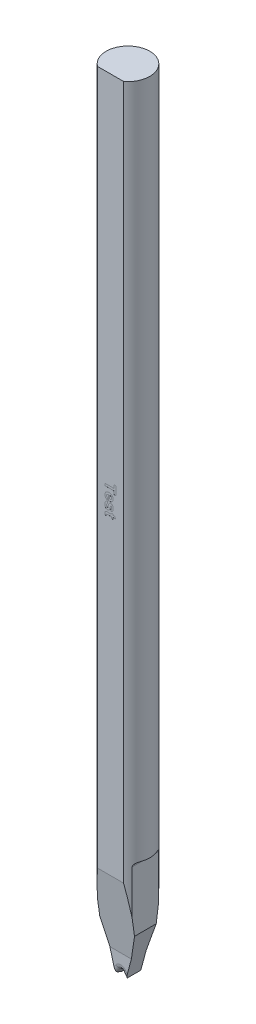
from build123d import *

# Parameters (mm, degrees)
SKETCH_TL_CUTTING_R       = 1.99771
TL_CUTTING_DEPTH          = 72.009
SKETCH_TDF_GRINDING_W     = 4.01542
SKETCH_TDF_GRINDING_H     = 4.01542
TDF_GRINDING_DEPTH        = 73.064400167
ENGRAVING_DEPTH           = 0.005
VW_VR_GRINDING_DEPTH      = 2.00771
VW_VR_GRINDING_DEPTH_BACK = 2.00771
ISA_GRINDING_DEPTH        = 2.00771
ISA_GRINDING_DEPTH_BACK   = 2.00771
PRE_FRX_BRX_DEPTH         = 2.00771
PRE_FRX_BRX_DEPTH_BACK    = 2.00771
SKETCH_PRE_FRX_BRX_W      = 1.33334
SKETCH_PRE_FRX_BRX_H      = 1.80086
FR_EDM_R                  = 0.50038
BR_EDM_R                  = 0.24892
FA_BA_GRINDING_DEPTH      = 2.00771
FA_BA_GRINDING_DEPTH_BACK = 2.00771


with BuildPart() as part:
    # sketch_TL_cutting → TL_cutting (new body)
    with BuildSketch(Plane(origin=(0, 0, 0), x_dir=(1, 0, 0), z_dir=(0, 1, 0))):
        Circle(SKETCH_TL_CUTTING_R)
    extrude(amount=TL_CUTTING_DEPTH)

    # sketch_TDF_grinding → TDF_grinding (cut, through all)
    with BuildSketch(Plane(origin=(0, 0, 0), x_dir=(1, 0, 0), z_dir=(0, 1, 0))):
        with Locations((0, -3.60918)):
            Rectangle(SKETCH_TDF_GRINDING_W, SKETCH_TDF_GRINDING_H)
    extrude(amount=TDF_GRINDING_DEPTH, mode=Mode.SUBTRACT)

    # sketch_engraving → engraving (cut)
    # profile 1 of 4: a face of its own
    with BuildSketch(Plane.XY.offset(1.60147)):
        Polygon((-0.5, 39.271616667), (0.333333333, 39.271616667), (0.333333333, 39.566488462), (0.5, 39.566488462), (0.5, 38.784437179), (0.333333333, 38.784437179), (0.333333333, 39.079308974), (-0.5, 39.079308974), align=None)
    # profile 2 of 4: a face of its own
    with BuildSketch(Plane.XY.offset(1.60147)):
        with BuildLine():
            Line((-0.269230769, 38.245975641), (-0.294871795, 38.053667949))
            add(Edge.make_bspline(
                [(-0.294871795, 38.053667949), (-0.303536255, 38.05681341), (-0.32057243, 38.062998057), (-0.344863965, 38.074297447), (-0.36753558, 38.086927941), (-0.38870841, 38.100828818), (-0.40841008, 38.115948344), (-0.426226149, 38.132786464), (-0.442819851, 38.150522903), (-0.457401048, 38.169899569), (-0.470514378, 38.190430953), (-0.481988402, 38.212220233), (-0.491332973, 38.235441665), (-0.499158418, 38.2597436), (-0.505404699, 38.285236347), (-0.509771463, 38.312023912), (-0.51242458, 38.340071927), (-0.512686872, 38.359217543), (-0.512820513, 38.368972436)],
                knots=[0, 0, 0, 0, 1.071172907, 2.106154283, 3.1104349, 4.085737425, 5.048416355, 5.993087888, 6.932482331, 7.868664062, 8.80754521, 9.762367971, 10.726735429, 11.713584758, 12.728370439, 13.774815933, 14.866245336, 16, 16, 16, 16], degree=3))
            add(Edge.make_bspline(
                [(-0.512820513, 38.368972436), (-0.512443282, 38.384215689), (-0.51171073, 38.413816927), (-0.505852845, 38.456649619), (-0.496231539, 38.496468957), (-0.482996444, 38.533340518), (-0.465262586, 38.566968048), (-0.443980436, 38.597603584), (-0.418772334, 38.625277377), (-0.399264925, 38.640792304), (-0.389423077, 38.648619872)],
                knots=[0, 0, 0, 0, 1.15090686, 2.234973544, 3.257507168, 4.240282073, 5.185422152, 6.119941203, 7.051475585, 8, 8, 8, 8], degree=3))
            add(Edge.make_bspline(
                [(-0.389423077, 38.648619872), (-0.381046549, 38.654394615), (-0.364178666, 38.666023262), (-0.336856894, 38.680508975), (-0.307933811, 38.692778192), (-0.277558503, 38.703026223), (-0.245440266, 38.710801085), (-0.211772448, 38.716423673), (-0.176408554, 38.719566462), (-0.152316287, 38.7200751), (-0.140024038, 38.720334615)],
                knots=[0, 0, 0, 0, 0.924739034, 1.862154457, 2.806332648, 3.78003102, 4.774289357, 5.808656063, 6.881942244, 8, 8, 8, 8], degree=3))
            add(Edge.make_bspline(
                [(-0.140024038, 38.720334615), (-0.125455951, 38.720092004), (-0.096984123, 38.719617846), (-0.055513373, 38.715154498), (-0.016425807, 38.707818358), (0.020119322, 38.697410859), (0.054294407, 38.68413375), (0.086062076, 38.66795031), (0.115338437, 38.648566538), (0.141890673, 38.626338649), (0.165678093, 38.601889773), (0.186654734, 38.575901172), (0.204171816, 38.548142799), (0.218793413, 38.519037282), (0.22973775, 38.488097916), (0.237794287, 38.455712574), (0.242700593, 38.421739484), (0.243290251, 38.398569286), (0.243589744, 38.386800962)],
                knots=[0, 0, 0, 0, 1.22208028, 2.38843015, 3.495001974, 4.555551, 5.572102979, 6.566928721, 7.541284444, 8.51191166, 9.466805643, 10.399597494, 11.308905182, 12.215983304, 13.126946664, 14.056451325, 15.012856426, 16, 16, 16, 16], degree=3))
            add(Edge.make_bspline(
                [(0.243589744, 38.386800962), (0.243311261, 38.373629824), (0.242766301, 38.347855288), (0.237650471, 38.310275991), (0.229328986, 38.274795107), (0.217373094, 38.241526508), (0.202375393, 38.21026058), (0.183809309, 38.18120302), (0.161721866, 38.15441694), (0.136526927, 38.129657507), (0.107657568, 38.107731168), (0.075306929, 38.088791461), (0.039386169, 38.073001438), (-6.4395e-05, 38.06017711), (-0.043155579, 38.050702551), (-0.089766999, 38.044217904), (-0.139896801, 38.040520273), (-0.174473137, 38.040736108), (-0.192307692, 38.040847436)],
                knots=[0, 0, 0, 0, 0.994914541, 1.946943474, 2.860007193, 3.744253739, 4.613162343, 5.475451996, 6.343187588, 7.231728884, 8.139057486, 9.075471918, 10.058180036, 11.098621179, 12.205332334, 13.387827392, 14.65263521, 16, 16, 16, 16], degree=3))
            Line((-0.192307692, 38.040847436), (-0.192307692, 38.528026923))
            add(Edge.make_bspline(
                [(-0.192307692, 38.528026923), (-0.199190121, 38.527709192), (-0.212592416, 38.527090467), (-0.232195578, 38.524796627), (-0.250479259, 38.520657909), (-0.267812634, 38.515788971), (-0.283741268, 38.50914089), (-0.298585088, 38.501254096), (-0.312263908, 38.492043492), (-0.324637591, 38.481432151), (-0.335614883, 38.46980259), (-0.345276708, 38.457539783), (-0.353640982, 38.4446797), (-0.360224098, 38.430905392), (-0.365494916, 38.416500027), (-0.36902659, 38.40135782), (-0.371322908, 38.385602139), (-0.371635397, 38.374856811), (-0.371794872, 38.369373077)],
                knots=[0, 0, 0, 0, 1.231638706, 2.398395625, 3.522289669, 4.579947828, 5.613000372, 6.600997726, 7.58103015, 8.554716894, 9.508889492, 10.435482506, 11.342805004, 12.245087657, 13.158904806, 14.079635201, 15.019967576, 16, 16, 16, 16], degree=3))
            add(Edge.make_bspline(
                [(-0.371794872, 38.369373077), (-0.37147122, 38.362073831), (-0.370844355, 38.347936282), (-0.366452232, 38.327557955), (-0.358712143, 38.309068041), (-0.34792154, 38.292272797), (-0.333591606, 38.277328375), (-0.315339539, 38.264799025), (-0.293735149, 38.253844255), (-0.277667648, 38.248684811), (-0.269230769, 38.245975641)],
                knots=[0, 0, 0, 0, 1.004430367, 1.945431754, 2.851730883, 3.749038912, 4.678525969, 5.68064125, 6.782128749, 8, 8, 8, 8], degree=3))
        make_face()
        with BuildLine():
            add(Edge.make_bspline(
                [(-0.076923077, 38.233155128), (-0.0698403, 38.233483639), (-0.056046098, 38.234123437), (-0.035946701, 38.236260056), (-0.017148581, 38.239753965), (0.000200148, 38.244909045), (0.016332408, 38.250857578), (0.031252693, 38.258017474), (0.044751188, 38.266665927), (0.056718236, 38.276608372), (0.067663617, 38.28708548), (0.076749299, 38.298677324), (0.084970517, 38.310417813), (0.091312261, 38.322949906), (0.09644632, 38.335935061), (0.100044461, 38.349509996), (0.102017666, 38.363706733), (0.102379943, 38.373306988), (0.102564103, 38.378187179)],
                knots=[0, 0, 0, 0, 1.317155349, 2.565252013, 3.752617023, 4.863710936, 5.923691592, 6.944619286, 7.932291025, 8.893346204, 9.832040666, 10.740742434, 11.625065814, 12.490654946, 13.343074709, 14.215747339, 15.092993572, 16, 16, 16, 16], degree=3))
            add(Edge.make_bspline(
                [(0.102564103, 38.378187179), (0.102394824, 38.383402132), (0.102061251, 38.393678456), (0.099884751, 38.408748379), (0.096024349, 38.423032459), (0.09079949, 38.436639555), (0.083918898, 38.449540507), (0.0754807, 38.461735603), (0.065590542, 38.473270723), (0.058097667, 38.480221161), (0.054286859, 38.48375609)],
                knots=[0, 0, 0, 0, 1.043516863, 2.056302107, 3.038302912, 3.998520634, 4.966791607, 5.956307719, 6.960596886, 8, 8, 8, 8], degree=3))
            add(Edge.make_bspline(
                [(0.054286859, 38.48375609), (0.050143389, 38.487049206), (0.04181864, 38.493665486), (0.028026538, 38.502086823), (0.013220128, 38.509308805), (-0.002752654, 38.515151047), (-0.019802657, 38.519527844), (-0.037911914, 38.522448646), (-0.057052364, 38.524307277), (-0.070174406, 38.524514764), (-0.076923077, 38.524621474)],
                knots=[0, 0, 0, 0, 0.903766344, 1.81577923, 2.754803886, 3.715080786, 4.716965023, 5.758108642, 6.846994466, 8, 8, 8, 8], degree=3))
            Line((-0.076923077, 38.524621474), (-0.076923077, 38.233155128))
        make_face(mode=Mode.SUBTRACT)
    # profile 3 of 4: a face of its own
    with BuildSketch(Plane.XY.offset(1.60147)):
        with BuildLine():
            Line((-0.282051282, 37.963924359), (-0.256410256, 37.771616667))
            add(Edge.make_bspline(
                [(-0.256410256, 37.771616667), (-0.265392316, 37.769308786), (-0.282694005, 37.764863233), (-0.306215409, 37.753602879), (-0.326584524, 37.739486729), (-0.343301626, 37.721699528), (-0.356462242, 37.70035559), (-0.365240358, 37.675137989), (-0.37099337, 37.646408413), (-0.37151826, 37.62594851), (-0.371794872, 37.615166346)],
                knots=[0, 0, 0, 0, 1.039319445, 2.001988807, 2.911187514, 3.807680854, 4.723381073, 5.705509029, 6.790826147, 8, 8, 8, 8], degree=3))
            add(Edge.make_bspline(
                [(-0.371794872, 37.615166346), (-0.371595476, 37.6033799), (-0.371221553, 37.581277061), (-0.365704055, 37.55056632), (-0.358276706, 37.523830835), (-0.349217718, 37.509115088), (-0.344951923, 37.502185577)],
                knots=[0, 0, 0, 0, 1.198484229, 2.247488828, 3.174758401, 4, 4, 4, 4], degree=3))
            add(Edge.make_bspline(
                [(-0.344951923, 37.502185577), (-0.341742613, 37.498232291), (-0.33550118, 37.490543982), (-0.322943507, 37.482741952), (-0.309159996, 37.477548698), (-0.299329041, 37.477017951), (-0.294270833, 37.476744872)],
                knots=[0, 0, 0, 0, 1.030872991, 2.004830756, 2.973448591, 4, 4, 4, 4], degree=3))
            add(Edge.make_bspline(
                [(-0.294270833, 37.476744872), (-0.29084777, 37.476875774), (-0.284161693, 37.477131458), (-0.274600311, 37.479806895), (-0.265958556, 37.484297368), (-0.261079044, 37.488462599), (-0.258613782, 37.490566987)],
                knots=[0, 0, 0, 0, 1.045349703, 2.041822997, 3.010676005, 4, 4, 4, 4], degree=3))
            add(Edge.make_bspline(
                [(-0.258613782, 37.490566987), (-0.256288912, 37.493632785), (-0.250848162, 37.500807485), (-0.244943535, 37.515139431), (-0.238900398, 37.533545958), (-0.235595409, 37.547422737), (-0.233774038, 37.555070192)],
                knots=[0, 0, 0, 0, 0.66039037, 1.545471194, 2.647315926, 4, 4, 4, 4], degree=3))
            add(Edge.make_bspline(
                [(-0.233774038, 37.555070192), (-0.229705714, 37.573716174), (-0.22194668, 37.609277449), (-0.209757361, 37.659778792), (-0.19774553, 37.704848274), (-0.186203797, 37.744635975), (-0.174918001, 37.779106417), (-0.163759522, 37.808213265), (-0.153049809, 37.832079784), (-0.144879526, 37.845529946), (-0.141225962, 37.851544551)],
                knots=[0, 0, 0, 0, 1.469060602, 2.801765397, 3.998694248, 5.05919304, 5.990566457, 6.789528243, 7.45870461, 8, 8, 8, 8], degree=3))
            add(Edge.make_bspline(
                [(-0.141225962, 37.851544551), (-0.136226873, 37.858402589), (-0.126466322, 37.871792676), (-0.109659896, 37.889628181), (-0.091386741, 37.904751367), (-0.071590355, 37.917116522), (-0.050318141, 37.926554447), (-0.027668833, 37.93345572), (-0.003546555, 37.937452085), (0.013006297, 37.938002888), (0.021434295, 37.938283333)],
                knots=[0, 0, 0, 0, 1.056974227, 2.063706289, 3.045111424, 4.005796011, 4.963194591, 5.937303459, 6.949763919, 8, 8, 8, 8], degree=3))
            add(Edge.make_bspline(
                [(0.021434295, 37.938283333), (0.029124721, 37.938038093), (0.04431443, 37.937553707), (0.06658025, 37.934147557), (0.08788195, 37.928268829), (0.108244702, 37.919987356), (0.127669101, 37.909371186), (0.146109736, 37.896355985), (0.163499189, 37.88105958), (0.18008332, 37.863595441), (0.195101302, 37.843560205), (0.208193344, 37.820898789), (0.219189739, 37.795682252), (0.228160641, 37.767891932), (0.235116926, 37.737522892), (0.240034197, 37.704574691), (0.243059894, 37.669109271), (0.243409494, 37.644619752), (0.243589744, 37.631993269)],
                knots=[0, 0, 0, 0, 0.866628782, 1.711717909, 2.531497577, 3.35182975, 4.18367977, 5.02092497, 5.890294189, 6.790012725, 7.730721042, 8.705258537, 9.733001209, 10.825364086, 11.991866675, 13.2403337, 14.577151382, 16, 16, 16, 16], degree=3))
            add(Edge.make_bspline(
                [(0.243589744, 37.631993269), (0.243446899, 37.619969386), (0.243169634, 37.596630784), (0.240731219, 37.562865029), (0.236899188, 37.531447838), (0.230948561, 37.502523753), (0.223974046, 37.475757243), (0.214898634, 37.451540721), (0.204526083, 37.429543073), (0.19215876, 37.410057891), (0.178364946, 37.392312816), (0.162861914, 37.376343528), (0.145977964, 37.361660901), (0.127601745, 37.348295817), (0.107595464, 37.336522221), (0.085933763, 37.326346763), (0.062896123, 37.317199482), (0.046718542, 37.312484647), (0.038461538, 37.310078205)],
                knots=[0, 0, 0, 0, 1.38031105, 2.679211982, 3.884975083, 5.011116117, 6.067453267, 7.057174624, 7.976132094, 8.854607518, 9.701157373, 10.55241532, 11.405604341, 12.267429654, 13.157569633, 14.066300783, 15.01304394, 16, 16, 16, 16], degree=3))
            Line((0.038461538, 37.310078205), (0.012820513, 37.502385897))
            add(Edge.make_bspline(
                [(0.012820513, 37.502385897), (0.019716836, 37.504290158), (0.033104434, 37.507986834), (0.051141649, 37.517171289), (0.066892754, 37.528329959), (0.079947134, 37.542237254), (0.090451531, 37.559028536), (0.097449696, 37.579068362), (0.101956518, 37.602011397), (0.102353946, 37.618347086), (0.102564103, 37.626985256)],
                knots=[0, 0, 0, 0, 1.018112573, 1.976427386, 2.86989064, 3.759232895, 4.678909429, 5.673224298, 6.76962116, 8, 8, 8, 8], degree=3))
            add(Edge.make_bspline(
                [(0.102564103, 37.626985256), (0.102424935, 37.637692738), (0.102166286, 37.657593004), (0.098045863, 37.684877454), (0.092323932, 37.707867567), (0.085068416, 37.720248276), (0.081730769, 37.72594359)],
                knots=[0, 0, 0, 0, 1.252081424, 2.327041614, 3.230413832, 4, 4, 4, 4], degree=3))
            add(Edge.make_bspline(
                [(0.081730769, 37.72594359), (0.079197183, 37.729025647), (0.074335374, 37.73493994), (0.064913663, 37.741325197), (0.054472552, 37.745380868), (0.047046059, 37.745775133), (0.043269231, 37.745975641)],
                knots=[0, 0, 0, 0, 1.057832138, 2.029920023, 2.998093444, 4, 4, 4, 4], degree=3))
            add(Edge.make_bspline(
                [(0.043269231, 37.745975641), (0.040033897, 37.745731951), (0.033581253, 37.745245928), (0.024317894, 37.741659065), (0.015848023, 37.735669869), (0.011363278, 37.730206983), (0.009014423, 37.727345833)],
                knots=[0, 0, 0, 0, 0.958252903, 1.911167308, 2.905987877, 4, 4, 4, 4], degree=3))
            add(Edge.make_bspline(
                [(0.009014423, 37.727345833), (0.007272068, 37.724647565), (0.003109312, 37.718200986), (-0.001987057, 37.705738151), (-0.007675168, 37.689579504), (-0.014111167, 37.66960725), (-0.021107365, 37.645777407), (-0.028443749, 37.617971341), (-0.036209836, 37.586289843), (-0.044306367, 37.551842427), (-0.052630208, 37.516856792), (-0.061887965, 37.483641001), (-0.071549097, 37.453239038), (-0.082070854, 37.425689873), (-0.092726589, 37.400866602), (-0.103967718, 37.378881411), (-0.115635077, 37.359626043), (-0.124552329, 37.348458363), (-0.12880609, 37.34313109)],
                knots=[0, 0, 0, 0, 0.374467347, 0.894660112, 1.565561736, 2.376893081, 3.344161852, 4.465830414, 5.734896654, 7.153471884, 8.598442955, 9.934182422, 11.179548312, 12.322244199, 13.376910086, 14.332509539, 15.204563813, 16, 16, 16, 16], degree=3))
            add(Edge.make_bspline(
                [(-0.12880609, 37.34313109), (-0.133161207, 37.338397939), (-0.141766598, 37.329045582), (-0.156708359, 37.317267826), (-0.172517892, 37.306827029), (-0.189865737, 37.298743237), (-0.208297358, 37.292224129), (-0.22803715, 37.287604372), (-0.249067342, 37.285099915), (-0.263482048, 37.284661013), (-0.270833333, 37.284437179)],
                knots=[0, 0, 0, 0, 0.971012965, 1.9186502, 2.868006896, 3.82989672, 4.803792202, 5.820095146, 6.888280979, 8, 8, 8, 8], degree=3))
            add(Edge.make_bspline(
                [(-0.270833333, 37.284437179), (-0.278992426, 37.284735435), (-0.295065709, 37.285322994), (-0.31877832, 37.289130371), (-0.34148056, 37.29590885), (-0.363516332, 37.304828098), (-0.384457432, 37.316865706), (-0.404505714, 37.331398777), (-0.423895683, 37.348291114), (-0.442088641, 37.367910642), (-0.458702848, 37.390179566), (-0.473419718, 37.414886937), (-0.485630501, 37.442216147), (-0.495629007, 37.472011312), (-0.503343888, 37.504335073), (-0.50897222, 37.5391443), (-0.51206406, 37.576448424), (-0.512563429, 37.602140104), (-0.512820513, 37.615366667)],
                knots=[0, 0, 0, 0, 0.853005228, 1.680406763, 2.502135431, 3.325285981, 4.159928718, 5.020072903, 5.910500533, 6.844018396, 7.811498054, 8.809909951, 9.84399402, 10.934451331, 12.090792638, 13.314110396, 14.617253208, 16, 16, 16, 16], degree=3))
            add(Edge.make_bspline(
                [(-0.512820513, 37.615366667), (-0.512612848, 37.62745682), (-0.51220841, 37.65100301), (-0.509517578, 37.685359126), (-0.504407099, 37.717718929), (-0.497724819, 37.748140888), (-0.489040825, 37.776683279), (-0.478560901, 37.803305401), (-0.465826863, 37.827975098), (-0.451129931, 37.85061131), (-0.434940139, 37.871488229), (-0.417179349, 37.890400578), (-0.398157879, 37.907538513), (-0.377590042, 37.922532075), (-0.355813358, 37.935929627), (-0.332587631, 37.947268496), (-0.307935086, 37.956851386), (-0.290780182, 37.961539112), (-0.282051282, 37.963924359)],
                knots=[0, 0, 0, 0, 1.27602789, 2.485129288, 3.633323873, 4.730967468, 5.769800648, 6.778755409, 7.74637841, 8.694428407, 9.62340196, 10.530821678, 11.429165597, 12.321379864, 13.213343615, 14.124177522, 15.045528489, 16, 16, 16, 16], degree=3))
        make_face()
    # profile 4 of 4: a face of its own
    with BuildSketch(Plane.XY.offset(1.60147)):
        with BuildLine():
            Line((0.230769231, 36.771616667), (0.08974359, 36.771616667))
            Line((0.08974359, 36.771616667), (0.08974359, 36.912642308))
            Line((0.08974359, 36.912642308), (-0.224358974, 36.912642308))
            add(Edge.make_bspline(
                [(-0.224358974, 36.912642308), (-0.231904339, 36.912655556), (-0.246127351, 36.91268053), (-0.266228543, 36.912516237), (-0.283853768, 36.912035979), (-0.299018236, 36.911753629), (-0.311701045, 36.911074066), (-0.321861303, 36.910566773), (-0.329566697, 36.909844169), (-0.338907815, 36.908116455), (-0.35057578, 36.903088956), (-0.360389431, 36.893421483), (-0.366182432, 36.883899126), (-0.369474906, 36.875870251), (-0.371514578, 36.867071013), (-0.371700117, 36.86090399), (-0.371794872, 36.857754487)],
                knots=[0, 0, 0, 0, 1.773599637, 3.343235314, 4.724802322, 5.918078765, 6.908020279, 7.709878159, 8.309605123, 8.725167438, 9.94114383, 11.228754835, 11.890951744, 12.552590386, 13.260806876, 14, 14, 14, 14], degree=3))
            add(Edge.make_bspline(
                [(-0.371794872, 36.857754487), (-0.371507964, 36.852599495), (-0.37087716, 36.841265574), (-0.367095421, 36.822790849), (-0.361305779, 36.801332787), (-0.356131124, 36.786144648), (-0.353365385, 36.778026923)],
                knots=[0, 0, 0, 0, 0.75345353, 1.656565626, 2.747486109, 4, 4, 4, 4], degree=3))
            Line((-0.353365385, 36.778026923), (-0.487379808, 36.758796154))
            add(Edge.make_bspline(
                [(-0.487379808, 36.758796154), (-0.491390152, 36.770473487), (-0.499569528, 36.79429022), (-0.506906498, 36.832144946), (-0.512003384, 36.872037386), (-0.512543433, 36.899403162), (-0.512820513, 36.91344359)],
                knots=[0, 0, 0, 0, 0.939563481, 1.916305015, 2.930928536, 4, 4, 4, 4], degree=3))
            add(Edge.make_bspline(
                [(-0.512820513, 36.91344359), (-0.512564303, 36.922066227), (-0.512063975, 36.938904556), (-0.50889268, 36.963561395), (-0.50326966, 36.986850275), (-0.495519476, 37.008603835), (-0.485995694, 37.028249445), (-0.475305475, 37.045552282), (-0.462868601, 37.059745517), (-0.449141562, 37.071601308), (-0.433202705, 37.080952612), (-0.415065056, 37.088376561), (-0.394648734, 37.094756812), (-0.380046946, 37.097370521), (-0.372395833, 37.098740064)],
                knots=[0, 0, 0, 0, 1.203015215, 2.349253984, 3.460901624, 4.539344044, 5.564274864, 6.502382232, 7.367332183, 8.186789841, 9.022345106, 9.932420497, 10.916620053, 12, 12, 12, 12], degree=3))
            add(Edge.make_bspline(
                [(-0.372395833, 37.098740064), (-0.369192653, 37.099220274), (-0.362066116, 37.100288659), (-0.35025766, 37.101738229), (-0.336212257, 37.102632671), (-0.319980191, 37.103365635), (-0.301558032, 37.104305843), (-0.280981809, 37.104504627), (-0.258215711, 37.105079957), (-0.242321525, 37.104994749), (-0.233974359, 37.10495)],
                knots=[0, 0, 0, 0, 0.560521704, 1.24706641, 2.057998689, 2.995119087, 4.059211621, 5.249632546, 6.555586685, 8, 8, 8, 8], degree=3))
            Line((-0.233974359, 37.10495), (0.08974359, 37.10495))
            Line((0.08974359, 37.10495), (0.08974359, 37.19469359))
            Line((0.08974359, 37.19469359), (0.230769231, 37.19469359))
            Line((0.230769231, 37.19469359), (0.230769231, 37.10495))
            Line((0.230769231, 37.10495), (0.371794872, 37.10495))
            Line((0.371794872, 37.10495), (0.487179487, 36.912642308))
            Line((0.487179487, 36.912642308), (0.230769231, 36.912642308))
            Line((0.230769231, 36.912642308), (0.230769231, 36.771616667))
        make_face()
    extrude(amount=-ENGRAVING_DEPTH, mode=Mode.SUBTRACT)

    # sketch_VW_VR_grinding → VW_VR_grinding (cut, two sides: drawn at the far end of the back side and taken through both)
    with BuildSketch(Plane.XY.offset(-VW_VR_GRINDING_DEPTH_BACK)):
        with BuildLine():
            Line((-1.59004, -0.01), (-1.59004, 9.681972))
            ThreePointArc((-1.59004, 9.681972), (-1.683182387, 9.906837613), (-1.908048, 9.99998))
            Line((-1.908048, 9.99998), (-2.00771, 9.99998))
            Line((-2.00771, 9.99998), (-2.00771, -0.01))
            Line((-2.00771, -0.01), (-1.59004, -0.01))
        make_face()
        with BuildLine():
            Line((1.59004, -0.01), (1.59004, 9.681972))
            ThreePointArc((1.59004, 9.681972), (1.683182387, 9.906837613), (1.908048, 9.99998))
            Line((1.908048, 9.99998), (2.00771, 9.99998))
            Line((2.00771, 9.99998), (2.00771, -0.01))
            Line((2.00771, -0.01), (1.59004, -0.01))
        make_face()
    extrude(amount=VW_VR_GRINDING_DEPTH + VW_VR_GRINDING_DEPTH_BACK, mode=Mode.SUBTRACT)

    # sketch_ISA_grinding → ISA_grinding (cut, two sides: drawn at the far end of the back side and taken through both)
    with BuildSketch(Plane.XY.offset(-ISA_GRINDING_DEPTH_BACK)):
        Polygon((-0.50038, 0), (-2.00771, 5.625432144), (-2.00771, -0.01), (2.00771, -0.01), (2.00771, 5.625432144), (0.50038, 0), align=None)
    extrude(amount=ISA_GRINDING_DEPTH + ISA_GRINDING_DEPTH_BACK, mode=Mode.SUBTRACT)

    # sketch_pre_FRX_BRX → pre_FRX_BRX (cut, two sides: drawn at the far end of the back side and taken through both)
    with BuildSketch(Plane(origin=(0, 0, 0), x_dir=(0, 0, -1), z_dir=(1, 0, 0)).offset(-PRE_FRX_BRX_DEPTH_BACK)):
        with Locations((-1.34104, 0.89043)):
            Rectangle(SKETCH_PRE_FRX_BRX_W, SKETCH_PRE_FRX_BRX_H)
        with Locations((1.34104, 0.89043)):
            Rectangle(SKETCH_PRE_FRX_BRX_W, SKETCH_PRE_FRX_BRX_H)
    extrude(amount=PRE_FRX_BRX_DEPTH + PRE_FRX_BRX_DEPTH_BACK, mode=Mode.SUBTRACT)

    # V-Groove_EDM: sweep along a path in sketch_contour_V-Groove
    with BuildLine(Plane(origin=(0, 0, 0), x_dir=(0, 0, -1), z_dir=(1, 0, 0))) as v_groove_edm_path:
        Line((-1.60147, 0.3556), (0, 0.3556))
        Line((0, 0.3556), (1.99771, 0.3556))
    # sketch_section_V-Groove → V-Groove_EDM (sweep, cut)
    with BuildSketch(Plane.XY.offset(1.60147)):
        with BuildLine():
            Line((-2.765528006, -3.556), (-0.041851153, 0.333813669))
            ThreePointArc((-0.041851153, 0.333813669), (0, 0.3556), (0.041851153, 0.333813669))
            Line((0.041851153, 0.333813669), (2.765528006, -3.556))
            Line((2.765528006, -3.556), (-2.765528006, -3.556))
        make_face()
    sweep(path=v_groove_edm_path.line, mode=Mode.SUBTRACT)

    # FR_EDM
    fr_edm_edges = [part.edges().sort_by_distance(p)[0] for p in [
        (0.158720576, 0.166906834, 0.67437),
        (0, 0.3556, 0.67437),
        (-0.158720576, 0.166906834, 0.67437),
    ]]
    fillet(fr_edm_edges, radius=FR_EDM_R)

    # BR_EDM
    br_edm_edges = [part.edges().sort_by_distance(p)[0] for p in [
        (0.158720576, 0.166906834, -0.67437),
        (0, 0.3556, -0.67437),
        (-0.158720576, 0.166906834, -0.67437),
    ]]
    fillet(br_edm_edges, radius=BR_EDM_R)

    # sketch_FA_BA_grinding → FA_BA_grinding (cut, two sides: drawn at the far end of the back side and taken through both)
    with BuildSketch(Plane(origin=(0, 0, 0), x_dir=(0, 0, -1), z_dir=(1, 0, 0)).offset(-FA_BA_GRINDING_DEPTH_BACK)):
        Polygon((2.99771, 18.332283091), (2.99771, -0.1), (0.67437, -0.1), (0.67437, 1.80086), align=None)
        Polygon((-3.622078656, 22.774896919), (-0.67437, 1.80086), (-0.67437, -0.1), (-3.622078656, -0.1), align=None)
    extrude(amount=FA_BA_GRINDING_DEPTH + FA_BA_GRINDING_DEPTH_BACK, mode=Mode.SUBTRACT)


solid = part.part
